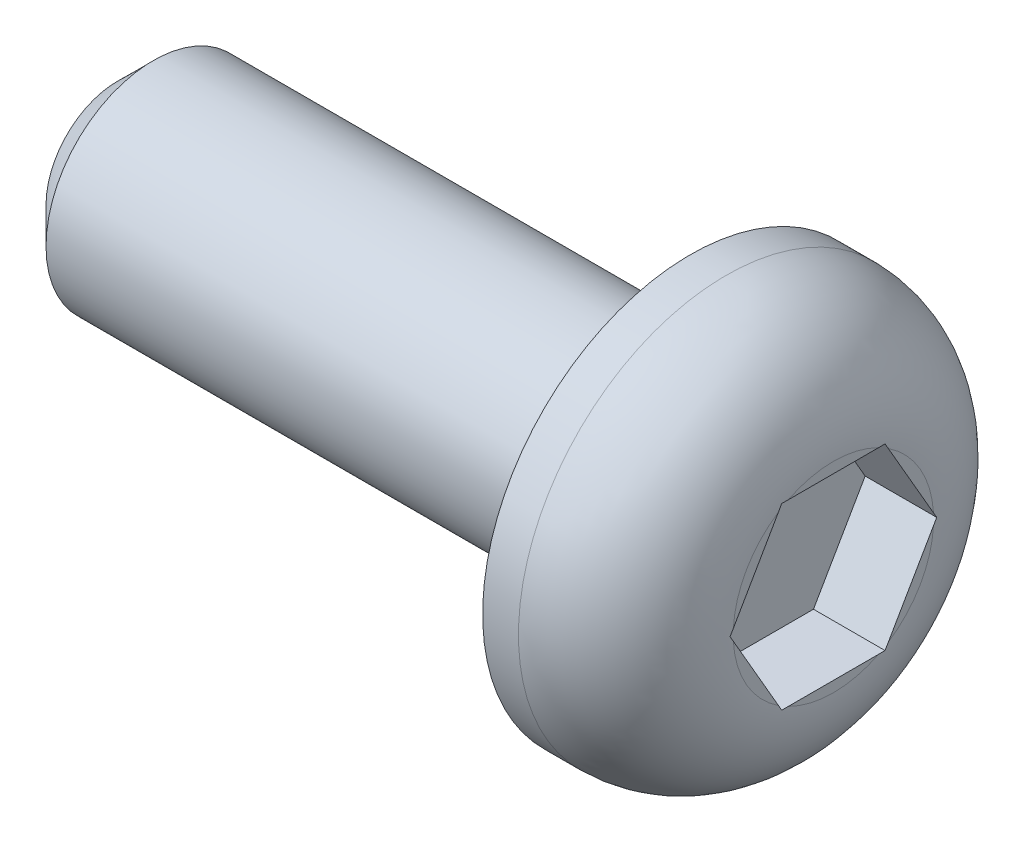
from build123d import *

# Parameters (mm, degrees)
CUT_EXTRUDE1_DEPTH = 1
FILLET1_R          = 1.5
CHAMFER1_SIZE      = 0.5


with BuildPart() as part:
    # Sketch1 → Revolve1 (revolve)
    with BuildSketch(Plane(origin=(0, 0, 0), x_dir=(1, 0, 0), z_dir=(0, 1, 0))):
        Polygon((0, 0), (-8, -9.8e-16), (-8, -1.500000000000001), (1e-17, -1.5), align=None)
        Polygon((1e-17, 1.3999999999999995), (1e-17, 0), (1e-17, -1.5), (2, -1.5), (2, 1.3999999999999995), align=None)
    revolve(axis=Axis((1e-17, 0, 1.5), (-1, 0, 1.4e-16)))

    # Sketch3 → Cut-Extrude1 (cut)
    with BuildSketch(Plane(origin=(2, 0, -2.7e-16), x_dir=(-1.3e-16, 0, -1), z_dir=(1, 0, -1.3e-16))):
        Polygon((-2.2216878364870323, -1.2500000000000002), (-0.7783121635129678, -1.2500000000000002), (-0.05662432702593554, 0), (-0.7783121635129678, 1.2500000000000002), (-2.2216878364870323, 1.2500000000000004), (-2.9433756729740645, 0), align=None)
    extrude(amount=-CUT_EXTRUDE1_DEPTH, mode=Mode.SUBTRACT)

    # Fillet1
    fillet1_edges = [part.edges().sort_by_distance(p)[0] for p in [
        (2.000000000000001, -3.6e-16, 4.3999999999999995),
    ]]
    fillet(fillet1_edges, radius=FILLET1_R - 0.0001)  # a hair under: the kernel refuses the full size

    # Chamfer1
    chamfer1_edges = [part.edges().sort_by_distance(p)[0] for p in [
        (-8, -1.8e-16, 3.0000000000000013),
    ]]
    chamfer(chamfer1_edges, length=CHAMFER1_SIZE)


solid = part.part
